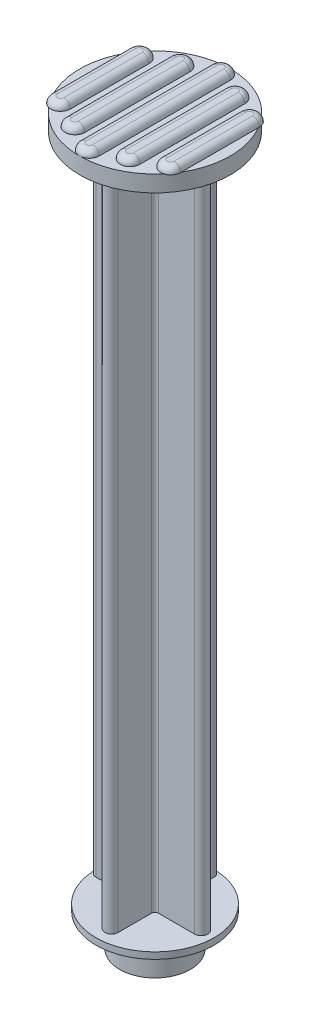
from build123d import *

# Parameters (mm, degrees)
BOSS_EXTRU_1_DEPTH = 102
ESQUISSE4_R        = 11.5
BOSS_EXTRU_2_DEPTH = 2.5
BOSS_EXTRU_3_DEPTH = 1
CONG_1_R           = 1


with BuildPart() as part:
    # Esquisse1 → Révolution1 (revolve)
    with BuildSketch(Plane.XY, mode=Mode.PRIVATE) as r_volution1_sk:
        Polygon((0, 0), (0, 6), (9, 6), (9, 5), (6, 5), (6, 3), (5.4, 3), (5.4, 0), align=None)
    revolve(r_volution1_sk.sketch.rotate(Axis((0, 0, 0), (0, 1, 0)), 90), axis=Axis((0, 0, 0), (0, 1, 0)))

    # Esquisse2 → Boss.-Extru.1 (add)
    with BuildSketch(Plane(origin=(0, 6, 0), x_dir=(1, 0, 0), z_dir=(0, 1, 0))):
        with BuildLine():
            Line((-8.004594421, 1), (-1.5, 1))
            ThreePointArc((-1.5, 1), (-1.146446609, 1.146446609), (-1, 1.5))
            Line((-1, 1.5), (-1, 8))
            ThreePointArc((-1, 8), (0, 9), (1, 8))
            Line((1, 8), (1, 1.5))
            ThreePointArc((1, 1.5), (1.146446609, 1.146446609), (1.5, 1))
            Line((1.5, 1), (7.046310989, 1))
            ThreePointArc((7.046310989, 1), (8.04103329, -0.005277699), (7.035755592, -1))
            Line((7.035755592, -1), (1.5, -1))
            ThreePointArc((1.5, -1), (1.146446609, -1.146446609), (1, -1.5))
            Line((1, -1.5), (1, -6.63449651))
            ThreePointArc((1, -6.63449651), (0, -7.63449651), (-1, -6.63449651))
            Line((-1, -6.63449651), (-1, -1.5))
            ThreePointArc((-1, -1.5), (-1.146446609, -1.146446609), (-1.5, -1))
            Line((-1.5, -1), (-8.004594421, -1))
            ThreePointArc((-8.004594421, -1), (-9.000010554, 0), (-8.004594421, 1))
        make_face()
    extrude(amount=BOSS_EXTRU_1_DEPTH)

    # Esquisse4 → Boss.-Extru.2 (add)
    with BuildSketch(Plane(origin=(0, 108, 0), x_dir=(1, 0, 0), z_dir=(0, 1, 0))):
        with Locations(Location((0, 0, 0), (0, 0, 270))):
            Circle(ESQUISSE4_R)
    extrude(amount=BOSS_EXTRU_2_DEPTH)

    # Esquisse5 → Boss.-Extru.3 (add)
    with BuildSketch(Plane(origin=(0, 110.5, 0), x_dir=(1, 0, 0), z_dir=(0, 1, 0))):
        with BuildLine():
            Line((-1.5, -10), (-1.5, 10))
            ThreePointArc((-1.5, 10), (0, 11.5), (1.5, 10))
            Line((1.5, 10), (1.5, -10))
            ThreePointArc((1.5, -10), (0, -11.5), (-1.5, -10))
        make_face()
        with BuildLine():
            Line((-5.7, -8), (-5.7, 8))
            ThreePointArc((-5.7, 8), (-4.2, 9.5), (-2.7, 8))
            Line((-2.7, 8), (-2.7, -8))
            ThreePointArc((-2.7, -8), (-4.2, -9.5), (-5.7, -8))
        make_face()
        with BuildLine():
            Line((-9.9, -6), (-9.9, 6))
            ThreePointArc((-9.9, 6), (-8.4, 7.5), (-6.9, 6))
            Line((-6.9, 6), (-6.9, -6))
            ThreePointArc((-6.9, -6), (-8.4, -7.5), (-9.9, -6))
        make_face()
        with BuildLine():
            Line((9.9, -6), (9.9, 6))
            ThreePointArc((9.9, 6), (8.4, 7.5), (6.9, 6))
            Line((6.9, 6), (6.9, -6))
            ThreePointArc((6.9, -6), (8.4, -7.5), (9.9, -6))
        make_face()
        with BuildLine():
            Line((5.7, -8), (5.7, 8))
            ThreePointArc((5.7, 8), (4.2, 9.5), (2.7, 8))
            Line((2.7, 8), (2.7, -8))
            ThreePointArc((2.7, -8), (4.2, -9.5), (5.7, -8))
        make_face()
    extrude(amount=BOSS_EXTRU_3_DEPTH)

    # Congé1
    cong_1_edges = [part.edges().sort_by_distance(p)[0] for p in [
        (-9.9, 111.5, 0),
        (-8.4, 111.5, -7.5),
        (-6.9, 111.5, 0),
        (-8.4, 111.5, 7.5),
        (-5.7, 111.5, 0),
        (-4.2, 111.5, -9.5),
        (-2.7, 111.5, 0),
        (-4.2, 111.5, 9.5),
        (-1.5, 111.5, 0),
        (0, 111.5, -11.5),
        (1.5, 111.5, 0),
        (0, 111.5, 11.5),
        (2.7, 111.5, 0),
        (4.2, 111.5, -9.5),
        (5.7, 111.5, 0),
        (4.2, 111.5, 9.5),
        (6.9, 111.5, 0),
        (8.4, 111.5, -7.5),
        (9.9, 111.5, 0),
        (8.4, 111.5, 7.5),
    ]]
    fillet(cong_1_edges, radius=CONG_1_R - 0.0001)  # a hair under: the kernel refuses the full size


solid = part.part
